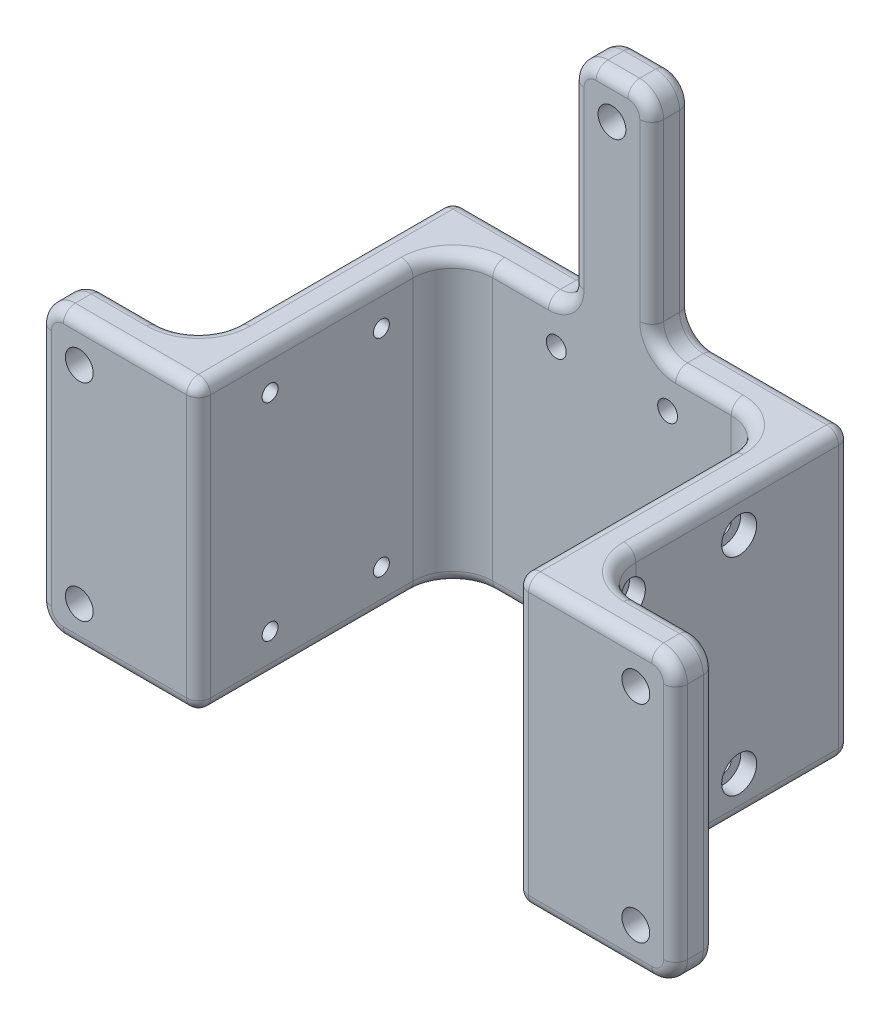
from build123d import *

# Parameters (mm, degrees)
SKETCH_1_W           = 50
SKETCH_1_H           = 36
EXTRUDE_1_DEPTH      = 5
SKETCH_2_R           = 1.25
CUT_EXTRUDE_1_DEPTH  = 5
SKETCH_3_R           = 2.2
CUT_EXTRUDE_2_DEPTH  = 2
SKETCH_8_W           = 32
SKETCH_8_H           = 36
SKETCH_8_R           = 1
EXTRUDE_3_DEPTH      = 5
SKETCH_9_R           = 2.2
CUT_EXTRUDE_4_DEPTH  = 2
SKETCH_10_W          = 15
SKETCH_10_H          = 36
SKETCH_10_R          = 1.75
EXTRUDE_4_DEPTH      = 5
EXTRUDE_START        = -5
SKETCH_11_W          = 32
SKETCH_11_H          = 36
SKETCH_11_R          = 1
EXTRUDE_5_DEPTH      = 5
CUT_EXTRUDE_START    = -2
SKETCH_12_R          = 2.2
CUT_EXTRUDE_5_DEPTH  = 2
SKETCH_18_W          = 15
SKETCH_18_H          = 36
SKETCH_18_R          = 1.75
EXTRUDE_6_DEPTH      = 5
SKETCH_20_R          = 3.2
CUT_EXTRUDE_8_DEPTH  = 2.5
SKETCH_21_R          = 3.2
CUT_EXTRUDE_9_DEPTH  = 2.5
FILLET_2_R           = 5
SKETCH_22_R          = 1.75
EXTRUDE_7_DEPTH      = 5
FILLET_3_R           = 3
SKETCH_23_R          = 3.2
CUT_EXTRUDE_10_DEPTH = 2.5
FILLET_6_R           = 3
FILLET_7_R           = 3
FILLET_8_R           = 1.5


with BuildPart() as part:
    # ｽｹｯﾁ1 → ﾎﾞｽ - 押し出し1 (new body)
    with BuildSketch(Plane.XY):
        Rectangle(SKETCH_1_W, SKETCH_1_H)
    extrude(amount=EXTRUDE_1_DEPTH)

    # ｽｹｯﾁ2 → ｶｯﾄ - 押し出し1 (cut)
    with BuildSketch(Plane(origin=(0, 0, 0), x_dir=(-1, 0, 0), z_dir=(0, 0, -1))):
        with Locations((-7, 13)):
            Circle(SKETCH_2_R)
        with Locations(Location((7, 13, 0), (0, 0, 180))):
            Circle(SKETCH_2_R)
        with Locations((7, -13)):
            Circle(SKETCH_2_R)
        with Locations(Location((-7, -13, 0), (0, 0, 180))):
            Circle(SKETCH_2_R)
    extrude(amount=-CUT_EXTRUDE_1_DEPTH, mode=Mode.SUBTRACT)

    # ｽｹｯﾁ3 → ｶｯﾄ - 押し出し2 (cut)
    with BuildSketch(Plane(origin=(0, 0, 0), x_dir=(-1, 0, 0), z_dir=(0, 0, -1))):
        with Locations((-7, 13)):
            Circle(SKETCH_3_R)
        with Locations(Location((7, 13, 0), (0, 0, 180))):
            Circle(SKETCH_3_R)
        with Locations((7, -13)):
            Circle(SKETCH_3_R)
        with Locations(Location((-7, -13, 0), (0, 0, 180))):
            Circle(SKETCH_3_R)
    extrude(amount=-CUT_EXTRUDE_2_DEPTH, mode=Mode.SUBTRACT)

    # ｽｹｯﾁ8 → ﾎﾞｽ - 押し出し3 (add)
    with BuildSketch(Plane(origin=(25, 0, 0), x_dir=(0, 0, -1), z_dir=(1, 0, 0))):
        with Locations((-21, 0)):
            Rectangle(SKETCH_8_W, SKETCH_8_H)
        with Locations(Location((-28, 13, 0), (0, 0, 90))):
            Circle(SKETCH_8_R, mode=Mode.SUBTRACT)
        with Locations(Location((-14, 13, 0), (0, 0, 270))):
            Circle(SKETCH_8_R, mode=Mode.SUBTRACT)
        with Locations(Location((-14, -13, 0), (0, 0, 90))):
            Circle(SKETCH_8_R, mode=Mode.SUBTRACT)
        with Locations(Location((-28, -13, 0), (0, 0, 270))):
            Circle(SKETCH_8_R, mode=Mode.SUBTRACT)
    extrude(amount=-EXTRUDE_3_DEPTH)

    # ｽｹｯﾁ9 → ｶｯﾄ - 押し出し4 (cut)
    with BuildSketch(Plane(origin=(25, 0, 0), x_dir=(0, 0, -1), z_dir=(1, 0, 0))):
        with Locations(Location((-28, 13, 0), (0, 0, 90))):
            Circle(SKETCH_9_R)
        with Locations(Location((-14, 13, 0), (0, 0, 270))):
            Circle(SKETCH_9_R)
        with Locations(Location((-14, -13, 0), (0, 0, 90))):
            Circle(SKETCH_9_R)
        with Locations(Location((-28, -13, 0), (0, 0, 270))):
            Circle(SKETCH_9_R)
    extrude(amount=-CUT_EXTRUDE_4_DEPTH, mode=Mode.SUBTRACT)

    # ｽｹｯﾁ10 → ﾎﾞｽ - 押し出し4 (add)
    with BuildSketch(Plane.XY.offset(37)):
        with Locations((32.5, 0)):
            Rectangle(SKETCH_10_W, SKETCH_10_H)
        with Locations((35, 13)):
            Circle(SKETCH_10_R, mode=Mode.SUBTRACT)
        with Locations(Location((35, -13, 0), (0, 0, 180))):
            Circle(SKETCH_10_R, mode=Mode.SUBTRACT)
    extrude(amount=-EXTRUDE_4_DEPTH)

    # ｽｹｯﾁ11 → ﾎﾞｽ - 押し出し5 (add)
    with BuildSketch(Plane.ZY.offset(25).offset(EXTRUDE_START)):
        with Locations((21, 0)):
            Rectangle(SKETCH_11_W, SKETCH_11_H)
        with Locations(Location((14, 13, 0), (0, 0, 270))):
            Circle(SKETCH_11_R, mode=Mode.SUBTRACT)
        with Locations(Location((28, 13, 0), (0, 0, 90))):
            Circle(SKETCH_11_R, mode=Mode.SUBTRACT)
        with Locations(Location((28, -13, 0), (0, 0, 270))):
            Circle(SKETCH_11_R, mode=Mode.SUBTRACT)
        with Locations(Location((14, -13, 0), (0, 0, 90))):
            Circle(SKETCH_11_R, mode=Mode.SUBTRACT)
    extrude(amount=EXTRUDE_5_DEPTH)

    # ｽｹｯﾁ12 → ｶｯﾄ - 押し出し5 (cut)
    with BuildSketch(Plane.ZY.offset(25).offset(CUT_EXTRUDE_START)):
        with Locations(Location((14, 13, 0), (0, 0, 270))):
            Circle(SKETCH_12_R)
        with Locations(Location((28, 13, 0), (0, 0, 90))):
            Circle(SKETCH_12_R)
        with Locations(Location((28, -13, 0), (0, 0, 270))):
            Circle(SKETCH_12_R)
        with Locations(Location((14, -13, 0), (0, 0, 90))):
            Circle(SKETCH_12_R)
    extrude(amount=CUT_EXTRUDE_5_DEPTH, mode=Mode.SUBTRACT)

    # ｽｹｯﾁ18 → ﾎﾞｽ - 押し出し6 (add)
    with BuildSketch(Plane.XY.offset(37)):
        with Locations((-32.5, 0)):
            Rectangle(SKETCH_18_W, SKETCH_18_H)
        with Locations((-35, 13)):
            Circle(SKETCH_18_R, mode=Mode.SUBTRACT)
        with Locations(Location((-35, -13, 0), (0, 0, 180))):
            Circle(SKETCH_18_R, mode=Mode.SUBTRACT)
    extrude(amount=-EXTRUDE_6_DEPTH)

    # ｽｹｯﾁ20 → ｶｯﾄ - 押し出し8 (cut)
    with BuildSketch(Plane(origin=(0, 0, 32), x_dir=(-1, 0, 0), z_dir=(0, 0, -1))):
        with Locations((-35, 13)):
            Circle(SKETCH_20_R)
        with Locations((-35, -13)):
            Circle(SKETCH_20_R)
    extrude(amount=-CUT_EXTRUDE_8_DEPTH, mode=Mode.SUBTRACT)

    # ｽｹｯﾁ21 → ｶｯﾄ - 押し出し9 (cut)
    with BuildSketch(Plane(origin=(0, 0, 32), x_dir=(-1, 0, 0), z_dir=(0, 0, -1))):
        with Locations((35, 13)):
            Circle(SKETCH_21_R)
        with Locations((35, -13)):
            Circle(SKETCH_21_R)
    extrude(amount=-CUT_EXTRUDE_9_DEPTH, mode=Mode.SUBTRACT)

    # ﾌｨﾚｯﾄ2
    # the kernel refuses this fillet: 5 mm, written as the material it adds along each edge
    with BuildSketch(Plane(origin=(20, -18, 5), x_dir=(0, 0, 1), z_dir=(0, 1, 0))) as fillet_2_piece_1:
        with BuildLine():
            CenterArc((FILLET_2_R, -FILLET_2_R), FILLET_2_R, 90, 90)
            Line((0, -FILLET_2_R), (0, 0))
            Line((0, 0), (FILLET_2_R, 0))
        make_face()
    extrude(amount=36)
    with BuildSketch(Plane(origin=(-20, 18, 5), x_dir=(1.0, 0, 3.4283687000424834e-12), z_dir=(0, -1, 0))) as fillet_2_piece_2:
        with BuildLine():
            CenterArc((FILLET_2_R, FILLET_2_R), FILLET_2_R, 180, 90)
            Line((0, FILLET_2_R), (0, 0))
            Line((0, 0), (FILLET_2_R, 0))
        make_face()
    extrude(amount=36)
    with BuildSketch(Plane(origin=(25, -18, 32), x_dir=(0, 0, -1), z_dir=(0, 1, 0))) as fillet_2_piece_3_section:
        with BuildLine():
            CenterArc((FILLET_2_R, -FILLET_2_R), FILLET_2_R, 90, 90)
            Line((0, -FILLET_2_R), (0, 0))
            Line((0, 0), (FILLET_2_R, 0))
        make_face()
    fillet_2_piece_3 = extrude(amount=36, mode=Mode.PRIVATE)
    fillet_2_piece_3 = fillet_2_piece_3 - Plane(origin=(26.171152878, -13, 28), x_dir=(0, -1, 0), z_dir=(1, 0, 0)) * Cylinder(2.2, 92, mode=Mode.PRIVATE)
    fillet_2_piece_3 = fillet_2_piece_3 - Plane(origin=(26.171152878, 13, 28), x_dir=(0, 1, 0), z_dir=(1, 0, 0)) * Cylinder(2.2, 92, mode=Mode.PRIVATE)
    add(fillet_2_piece_3)
    with BuildSketch(Plane(origin=(-25, 18, 32), x_dir=(-1, 0, 0), z_dir=(0, -1, 0))) as fillet_2_piece_4_section:
        with BuildLine():
            CenterArc((FILLET_2_R, FILLET_2_R), FILLET_2_R, 180, 90)
            Line((0, FILLET_2_R), (0, 0))
            Line((0, 0), (FILLET_2_R, 0))
        make_face()
    fillet_2_piece_4 = extrude(amount=36, mode=Mode.PRIVATE)
    fillet_2_piece_4 = fillet_2_piece_4 - Plane(origin=(-26.171152716, 13, 28), x_dir=(0, 1, 0), z_dir=(1, 0, 0)) * Cylinder(2.2, 92, mode=Mode.PRIVATE)
    fillet_2_piece_4 = fillet_2_piece_4 - Plane(origin=(-26.171152716, -13, 28), x_dir=(0, -1, 0), z_dir=(1, 0, 0)) * Cylinder(2.2, 92, mode=Mode.PRIVATE)
    add(fillet_2_piece_4)

    # ｽｹｯﾁ22 → ﾎﾞｽ - 押し出し7 (add)
    with BuildSketch(Plane(origin=(0, 0, 0), x_dir=(-1, 0, 0), z_dir=(0, 0, -1))):
        Polygon((-5, 18), (0, 18), (5, 18), (5, 46), (-5, 46), align=None)
        with Locations((0, 41)):
            Circle(SKETCH_22_R, mode=Mode.SUBTRACT)
    extrude(amount=-EXTRUDE_7_DEPTH)

    # ﾌｨﾚｯﾄ3
    # the kernel refuses this fillet: 3 mm, written as the material it adds along each edge
    with BuildSketch(Plane(origin=(-5, 18, 0), x_dir=(-1, 0, 0), z_dir=(0, 0, 1))) as fillet_3_piece_1:
        with BuildLine():
            CenterArc((FILLET_3_R, -FILLET_3_R), FILLET_3_R, 90, 90)
            Line((0, -FILLET_3_R), (0, 0))
            Line((0, 0), (FILLET_3_R, 0))
        make_face()
    extrude(amount=5)
    with BuildSketch(Plane(origin=(5, 18, 0), x_dir=(1, 0, 0), z_dir=(0, 0, 1))) as fillet_3_piece_2:
        with BuildLine():
            CenterArc((FILLET_3_R, FILLET_3_R), FILLET_3_R, 180, 90)
            Line((0, FILLET_3_R), (0, 0))
            Line((0, 0), (FILLET_3_R, 0))
        make_face()
    extrude(amount=5)

    # ｽｹｯﾁ23 → ｶｯﾄ - 押し出し10 (cut)
    with BuildSketch(Plane(origin=(0, 0, 0), x_dir=(-1, 0, 0), z_dir=(0, 0, -1))):
        with Locations((0, 41)):
            Circle(SKETCH_23_R)
    extrude(amount=-CUT_EXTRUDE_10_DEPTH, mode=Mode.SUBTRACT)

    # ﾌｨﾚｯﾄ6
    fillet_6_edges = [part.edges().sort_by_distance(p)[0] for p in [
        (-40, 18, 34.5),
        (-40, -18, 34.5),
        (40, -18, 34.5),
        (40, 18, 34.5),
    ]]
    fillet(fillet_6_edges, radius=FILLET_6_R)

    # ﾌｨﾚｯﾄ7
    fillet_7_edges = [part.edges().sort_by_distance(p)[0] for p in [
        (5, 46, 2.5),
        (-5, 46, 2.5),
    ]]
    fillet(fillet_7_edges, radius=FILLET_7_R)

    # ﾌｨﾚｯﾄ8
    fillet_8_edges = [part.edges().sort_by_distance(p)[0] for p in [
        (-20, 0, 37),
        (-28.5, 18, 37),
        (-28.5, -18, 37),
        (-20, 18, 23.5),
        (11.5, 18, 5),
        (0, -18, 5),
        (20, 18, 23.5),
        (-20, -18, 23.5),
        (25, 18, 13.5),
        (25, -18, 13.5),
        (33.5, -18, 32),
        (-25, -18, 13.5),
        (-25, 18, 13.5),
        (-33.5, 18, 32),
        (18.535533906, 18, 6.464466094),
        (18.535533906, -18, 6.464466094),
        (-18.535533906, -18, 6.464466094),
        (-18.535533906, 18, 6.464466094),
        (26.464466094, -18, 30.535533906),
        (26.464466094, 18, 30.535533906),
        (-26.464466094, 18, 30.535533906),
        (-26.464466094, -18, 30.535533906),
        (-11.5, 18, 5),
        (-16.5, 18, 0),
        (-5.878679656, 18.878679656, 0),
        (-5.878679656, 18.878679656, 5),
        (5.878679656, 18.878679656, 0),
        (5.878679656, 18.878679656, 5),
        (-40, 0, 37),
        (-39.121320344, -17.121320344, 37),
        (-39.121320344, 17.121320344, 37),
        (-40, 0, 32),
        (-33.5, -18, 32),
        (-39.121320344, -17.121320344, 32),
        (-39.121320344, 17.121320344, 32),
        (40, 0, 37),
        (39.121320344, 17.121320344, 37),
        (39.121320344, -17.121320344, 37),
        (40, 0, 32),
        (33.5, 18, 32),
        (39.121320344, 17.121320344, 32),
        (39.121320344, -17.121320344, 32),
        (0, 46, 0),
        (0, 46, 5),
        (-5, 32, 0),
        (5, 32, 0),
        (-4.121320344, 45.121320344, 0),
        (4.121320344, 45.121320344, 0),
        (5, 32, 5),
        (-5, 32, 5),
        (-4.121320344, 45.121320344, 5),
        (4.121320344, 45.121320344, 5),
        (16.5, 18, 0),
        (25, 0, 0),
        (0, -18, 0),
        (20, -18, 23.5),
        (20, 0, 37),
        (28.5, -18, 37),
        (-25, 0, 0),
        (28.5, 18, 37),
    ]]
    fillet(fillet_8_edges, radius=FILLET_8_R)


solid = part.part
